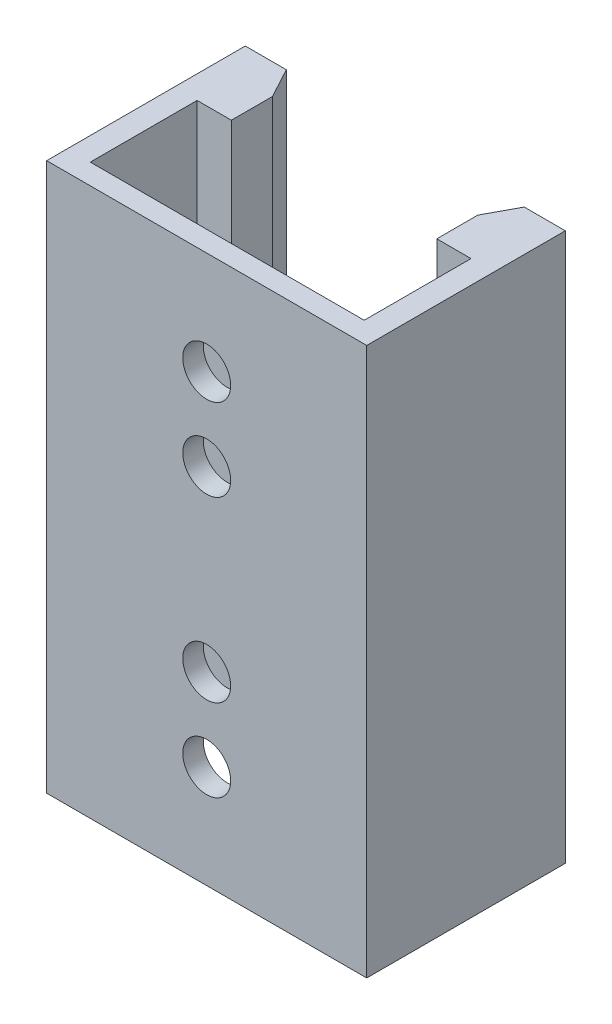
from build123d import *

# Parameters (mm, degrees)
BOSS_EXTRUDE1_DEPTH = 40
SKETCH2_R           = 1.75
CUT_EXTRUDE1_DEPTH  = 10


with BuildPart() as part:
    # Sketch1 → Boss-Extrude1 (new body)
    with BuildSketch(Plane(origin=(0, 0, 0), x_dir=(1, 0, 0), z_dir=(0, 1, 0))):
        Polygon((-11.683800623, 0), (11.683800623, 0), (11.683800623, 14.5), (8.683800623, 14.5), (7.5, 12.3), (7.5, 9.3), (10, 9.3), (10, 1.5), (-10, 1.5), (-10, 9.3), (-7.5, 9.3), (-7.5, 12.3), (-8.683800623, 14.5), (-11.683800623, 14.5), align=None)
    extrude(amount=BOSS_EXTRUDE1_DEPTH)

    # Sketch2 → Cut-Extrude1 (cut)
    with BuildSketch(Plane.XY):
        with Locations((0, 7.5)):
            Circle(SKETCH2_R)
        with Locations((0, 26.5)):
            Circle(SKETCH2_R)
        with Locations((0, 13.5)):
            Circle(SKETCH2_R)
        with Locations((0, 32.5)):
            Circle(SKETCH2_R)
    extrude(amount=-CUT_EXTRUDE1_DEPTH, mode=Mode.SUBTRACT)


solid = part.part
